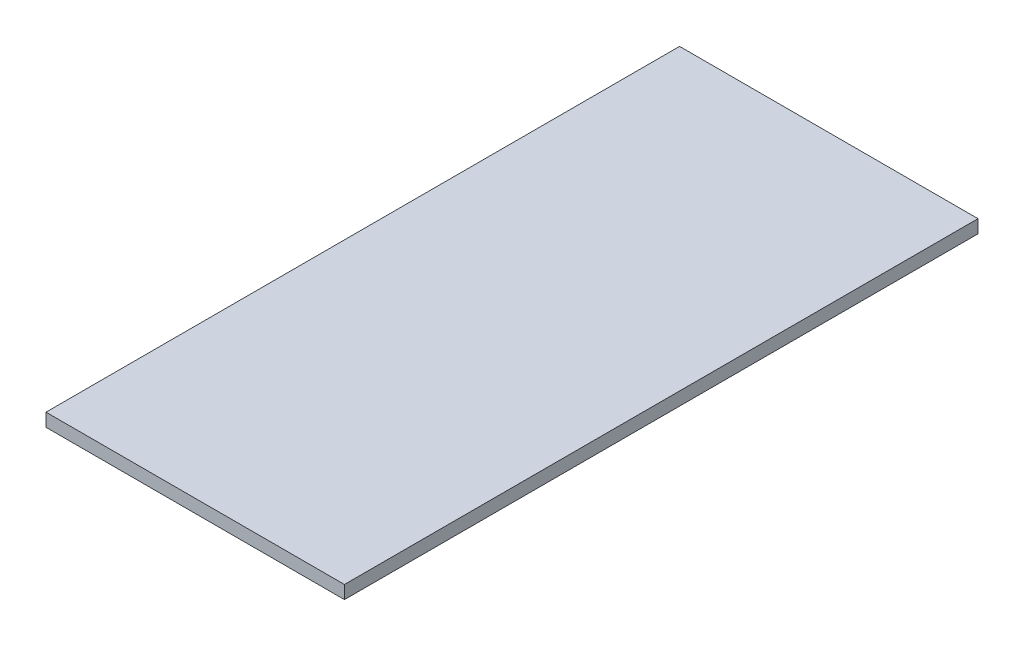
from build123d import *

# Parameters (mm, degrees)
SKETCH1_W           = 159.000776249
SKETCH1_H           = 337.554266017
BOSS_EXTRUDE1_DEPTH = 7


with BuildPart() as part:
    # Sketch1 → Boss-Extrude1 (new body)
    with BuildSketch(Plane(origin=(0, 0, 0), x_dir=(1, 0, 0), z_dir=(0, 1, 0))):
        with Locations((1.325, -61.276263003)):
            Rectangle(SKETCH1_W, SKETCH1_H)
    extrude(amount=BOSS_EXTRUDE1_DEPTH)


solid = part.part
